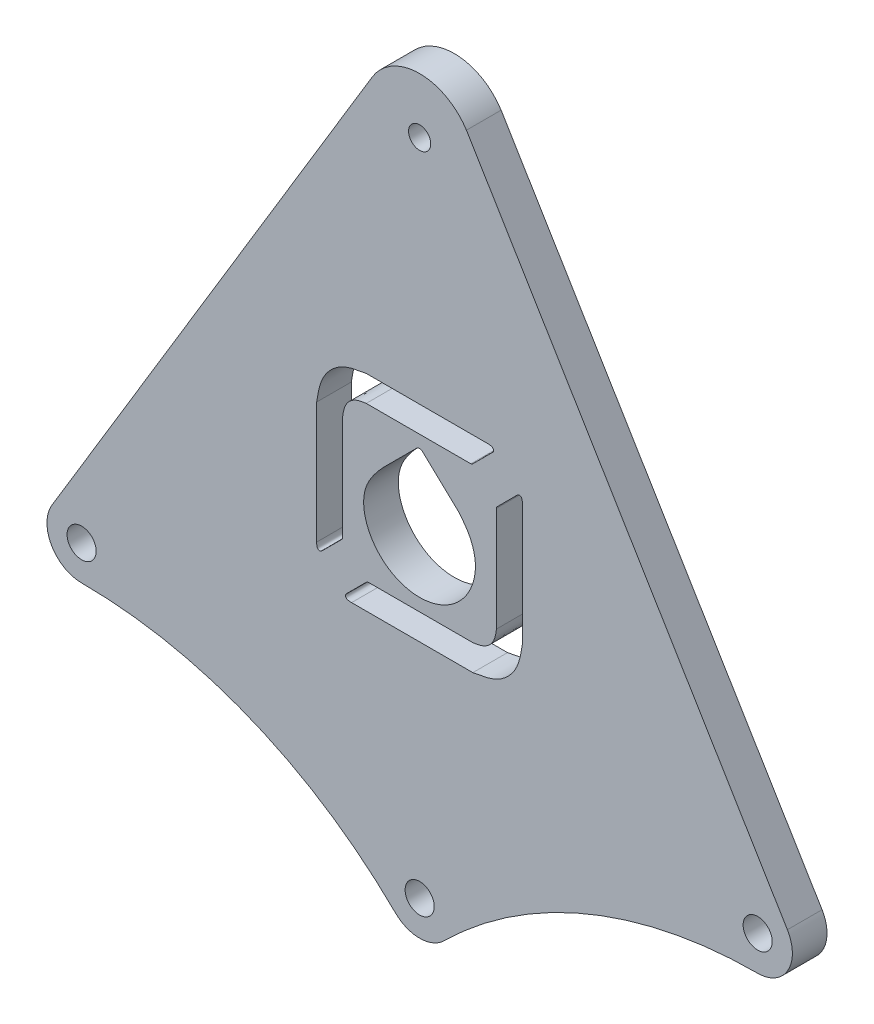
from build123d import *

# Parameters (mm, degrees)
SKETCH1_R           = 2.1
SKETCH1_R_2         = 1.6
BOSS_EXTRUDE1_DEPTH = 5
CUT_EXTRUDE1_DEPTH  = 117.288703235


with BuildPart() as part:
    # Sketch1 → Boss-Extrude1 (new body)
    with BuildSketch(Plane.XY):
        with BuildLine():
            Line((-6.849997051, 99.132498083), (-53.031248157, 22.582811302))
            ThreePointArc((-53.031248157, 22.582811302), (-53.103966956, 17.541754336), (-48.75, 15))
            ThreePointArc((-48.75, 15), (-24.301233146, 10.179806707), (-3.511536297, -3.559369724))
            ThreePointArc((-3.511536297, -3.559369724), (0, -5), (3.511536297, -3.559369724))
            ThreePointArc((3.511536297, -3.559369724), (24.301233146, 10.179806707), (48.75, 15))
            ThreePointArc((48.75, 15), (53.104000381, 17.541813538), (53.031177917, 22.582927727))
            Line((53.031177917, 22.582927727), (6.745924993, 99.300290221))
            ThreePointArc((6.745924993, 99.300290221), (-0.098723344, 102.999390833), (-6.849997051, 99.132498083))
        make_face()
        Circle(SKETCH1_R, mode=Mode.SUBTRACT)
        with Locations((-48.75, 20)):
            Circle(SKETCH1_R, mode=Mode.SUBTRACT)
        with Locations((48.75, 20)):
            Circle(SKETCH1_R, mode=Mode.SUBTRACT)
        with Locations((0, 95)):
            Circle(SKETCH1_R_2, mode=Mode.SUBTRACT)
    extrude(amount=BOSS_EXTRUDE1_DEPTH)

    # Sketch2 → Cut-Extrude1 (cut, through all)
    with BuildSketch(Plane.XY.offset(5)):
        with BuildLine():
            Line((-0.443864112, 55.984334269), (-5.297300405, 51.131179975))
            add(Edge.make_bspline(
                [(-5.297300405, 51.131179975), (-5.301766748, 51.127009417), (-5.310511324, 51.11884395), (-5.322913657, 51.106378091), (-5.78139226, 50.600055571), (-6.674828376, 49.554708202), (-7.775003562, 47.750327569), (-8.332785357, 44.927376908), (-7.290519819, 41.392117491), (-4.222914485, 38.330100966), (-0.002965829, 37.186656905), (4.213976272, 38.327822015), (7.269010111, 41.396137842), (8.277646634, 44.91662707), (7.767067878, 47.711666533), (6.853177127, 49.585300342), (5.979525982, 50.62775004), (5.557613885, 51.131179975)],
                knots=[0, 0, 0, 0, 0.000489092, 0.000957584, 0.001406885, 0.055155152, 0.111026991, 0.168427122, 0.280644353, 0.389809521, 0.502189722, 0.614354085, 0.723170681, 0.835316449, 0.891384032, 0.947546121, 1, 1, 1, 1], degree=3))
            Line((5.557613885, 51.131179975), (0.407774184, 55.984334269))
            add(Edge.make_bspline(
                [(0.407774184, 55.984334269), (0.368639039, 56.01821007), (0.291291772, 56.085162693), (0.15156375, 56.154427348), (0.050487127, 56.164249031), (0, 56.169154899)],
                knots=[0, 0, 0, 0, 0.338885039, 0.6697773, 1, 1, 1, 1], degree=3))
            add(Edge.make_bspline(
                [(0, 56.169154899), (-0.052633639, 56.164068541), (-0.161028147, 56.153593619), (-0.315260563, 56.089795141), (-0.401221102, 56.019303514), (-0.443864112, 55.984334269)],
                knots=[0, 0, 0, 0, 0.322338023, 0.663827768, 1, 1, 1, 1], degree=3))
        make_face()
        with BuildLine():
            Line((-7.706098588, 57.951066335), (7.372618255, 57.951066335))
            add(Edge.make_bspline(
                [(7.372618255, 57.951066335), (7.394754066, 57.952741312), (7.438148671, 57.956024902), (7.503316982, 57.963704879), (7.552503443, 57.989714726), (7.588483352, 58.015170692), (7.61178612, 58.0385611), (7.626086156, 58.053677663), (7.633071734, 58.061062115)],
                knots=[0, 0, 0, 0, 0.227492727, 0.445972237, 0.663373124, 0.787115425, 0.896005733, 1, 1, 1, 1], degree=3))
            Line((7.633071734, 58.061062115), (10.56002888, 60.988126261))
            add(Edge.make_bspline(
                [(10.56002888, 60.988126261), (10.588999398, 61.027414909), (10.647007319, 61.10608291), (10.671026663, 61.254274887), (10.643787951, 61.390199535), (10.576478759, 61.499703932), (10.486018248, 61.5786062), (10.353042857, 61.627990259), (10.192907602, 61.66028096), (10.007800719, 61.693592153), (9.877454096, 61.691038249), (9.80613809, 61.692556472), (9.793770576, 61.693180835), (9.785537684, 61.692596549), (9.781413437, 61.692303853)],
                knots=[0, 0, 0, 0, 0.104345134, 0.208931166, 0.313565445, 0.39799532, 0.482811187, 0.567894079, 0.701186565, 0.836715425, 0.973246641, 0.982162759, 0.991064478, 1, 1, 1, 1], degree=3))
            Line((9.781413437, 61.692303853), (-7.706098588, 61.692303853))
            add(Edge.make_bspline(
                [(-7.706098588, 61.692303853), (-8.954977035, 61.492774456), (-11.421020812, 61.098782367), (-14.261566727, 58.258297615), (-14.655543049, 55.791950747), (-14.85508629, 54.542782152)],
                knots=[0, 0, 0, 0, 0.336153842, 0.663771636, 1, 1, 1, 1], degree=3))
            Line((-14.85508629, 54.542782152), (-14.853675293, 37.055657126))
            add(Edge.make_bspline(
                [(-14.853675293, 37.055657126), (-14.853969375, 37.051675577), (-14.854550282, 37.04381073), (-14.853925359, 37.031949208), (-14.852358667, 36.960744234), (-14.855397231, 36.830160388), (-14.821608172, 36.644666062), (-14.791815493, 36.483796567), (-14.740306085, 36.351730946), (-14.661648646, 36.261445912), (-14.552461758, 36.193440165), (-14.416220728, 36.16617992), (-14.267691647, 36.190514979), (-14.188904909, 36.249229068), (-14.149498701, 36.27859568)],
                knots=[0, 0, 0, 0, 0.008621864, 0.017030969, 0.025643238, 0.162638148, 0.298245388, 0.431901383, 0.516391776, 0.601007159, 0.685956809, 0.790142009, 0.895036806, 1, 1, 1, 1], degree=3))
            Line((-14.149498701, 36.27859568), (-11.223921552, 39.205516826))
            add(Edge.make_bspline(
                [(-11.223921552, 39.205516826), (-11.214976838, 39.214780106), (-11.197424054, 39.232958029), (-11.170226536, 39.259966444), (-11.141538222, 39.295516864), (-11.121606315, 39.344610277), (-11.112021748, 39.403868417), (-11.112299367, 39.44372384), (-11.112443775, 39.464455309)],
                knots=[0, 0, 0, 0, 0.131285455, 0.257629811, 0.390972346, 0.594165008, 0.788898108, 1, 1, 1, 1], degree=3))
            Line((-11.112443775, 39.464455309), (-11.113854772, 54.542782152))
            add(Edge.make_bspline(
                [(-11.113854772, 54.542782152), (-11.025624037, 55.146716493), (-10.853184798, 56.327053242), (-9.491198067, 57.690108032), (-8.310427507, 57.862721315), (-7.706098588, 57.951066335)],
                knots=[0, 0, 0, 0, 0.338409749, 0.6613922, 1, 1, 1, 1], degree=3))
        make_face()
        with BuildLine():
            Line((7.67000866, 35.756025725), (-7.408318183, 35.756025725))
            add(Edge.make_bspline(
                [(-7.408318183, 35.756025725), (-7.427440936, 35.755294528), (-7.462587587, 35.753950624), (-7.516551065, 35.745516006), (-7.560850786, 35.725170186), (-7.600833788, 35.701425624), (-7.635315717, 35.675409267), (-7.657296392, 35.655135089), (-7.668774662, 35.644547948)],
                knots=[0, 0, 0, 0, 0.196745559, 0.361608386, 0.557261599, 0.692766378, 0.839563136, 1, 1, 1, 1], degree=3))
            Line((-7.668774662, 35.644547948), (-10.595729808, 32.717601802))
            add(Edge.make_bspline(
                [(-10.595729808, 32.717601802), (-10.624701104, 32.678293593), (-10.682693852, 32.599609121), (-10.706716869, 32.451443699), (-10.679538616, 32.315457358), (-10.611911158, 32.206024605), (-10.521503266, 32.127364297), (-10.389015109, 32.077411838), (-10.228910201, 32.044860654), (-10.043857278, 32.014590067), (-9.91330711, 32.009088715), (-9.841970676, 32.014306551), (-9.829509786, 32.013673376), (-9.8212444, 32.01350587), (-9.817116366, 32.013422211)],
                knots=[0, 0, 0, 0, 0.104384754, 0.208950226, 0.313569176, 0.398093487, 0.483012464, 0.567612364, 0.700915154, 0.836484685, 0.973043492, 0.982112009, 0.991066088, 1, 1, 1, 1], degree=3))
            Line((-9.817116366, 32.013422211), (7.67000866, 32.013422211))
            add(Edge.make_bspline(
                [(7.67000866, 32.013422211), (8.919019337, 32.213074659), (11.385431011, 32.607326795), (14.226516148, 35.448132826), (14.620076355, 37.914907651), (14.819389361, 39.164170909)],
                knots=[0, 0, 0, 0, 0.336156644, 0.663805911, 1, 1, 1, 1], degree=3))
            Line((14.819389361, 39.164170909), (14.817978364, 56.649953937))
            add(Edge.make_bspline(
                [(14.817978364, 56.649953937), (14.818270541, 56.654088186), (14.818856191, 56.662375028), (14.818228473, 56.674871586), (14.816744384, 56.746304358), (14.819286158, 56.876724441), (14.785908468, 57.061771429), (14.754075315, 57.221842187), (14.70406878, 57.354343023), (14.625479493, 57.444759405), (14.516043168, 57.512357705), (14.380018503, 57.539552733), (14.231550654, 57.515207627), (14.153067034, 57.456521815), (14.113797772, 57.427158383)],
                knots=[0, 0, 0, 0, 0.008953482, 0.017946692, 0.027021307, 0.163490993, 0.298949058, 0.432165007, 0.516776033, 0.601601228, 0.686034701, 0.790672378, 0.895262972, 1, 1, 1, 1], degree=3))
            Line((14.113797772, 57.427158383), (11.186877626, 54.500200237))
            add(Edge.make_bspline(
                [(11.186877626, 54.500200237), (11.177288202, 54.491001836), (11.158411099, 54.472894475), (11.129846255, 54.44509123), (11.099398849, 54.41184917), (11.082600471, 54.362398312), (11.077979491, 54.303834841), (11.077192377, 54.262984189), (11.076773846, 54.241262755)],
                knots=[0, 0, 0, 0, 0.134581529, 0.264928249, 0.404990742, 0.58604785, 0.779890073, 1, 1, 1, 1], degree=3))
            Line((11.076773846, 54.241262755), (11.077902844, 39.164170909))
            add(Edge.make_bspline(
                [(11.077902844, 39.164170909), (10.989969683, 38.560079286), (10.818115376, 37.37945816), (9.455283438, 36.016763389), (8.274418515, 35.844299203), (7.67000866, 35.756025725)],
                knots=[0, 0, 0, 0, 0.33840601, 0.661371999, 1, 1, 1, 1], degree=3))
        make_face()
    extrude(amount=-CUT_EXTRUDE1_DEPTH, mode=Mode.SUBTRACT)


solid = part.part
